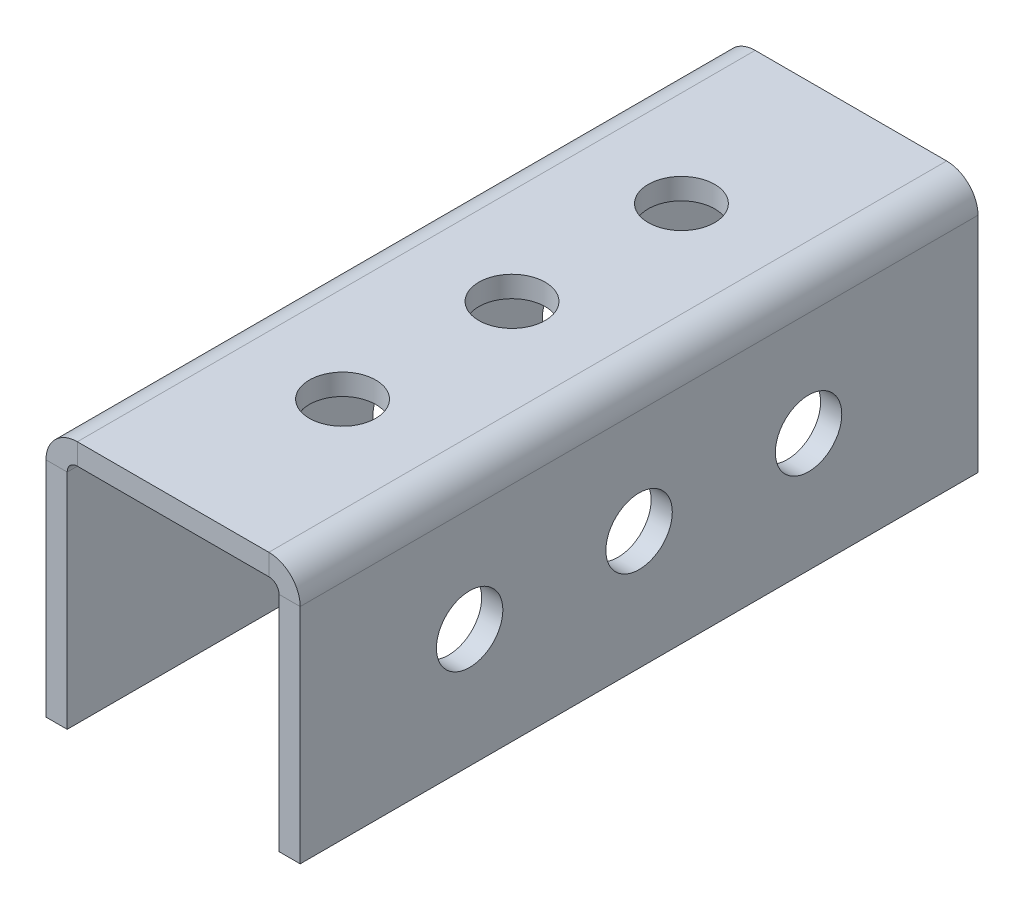
from build123d import *

# Parameters (mm, degrees)
BASE_FLANGE1_DEPTH = 50.8
SKETCH6_R          = 2.4892
CUT_EXTRUDE1_DEPTH = 56.084191244
SKETCH7_R          = 2.4892
CUT_EXTRUDE2_DEPTH = 58.501695627


# Sheet-metal steps are written as plain solids
with BuildPart() as part:
    # Sketch1 → Base-Flange1 (new body)
    with BuildSketch(Plane.XY):
        with BuildLine():
            Line((-9.525, 0), (-9.525, 16.7005))
            ThreePointArc((-9.525, 16.7005), (-8.836847382, 18.361847382), (-7.1755, 19.05))
            Line((-7.1755, 19.05), (7.1755, 19.05))
            ThreePointArc((7.1755, 19.05), (8.836847382, 18.361847382), (9.525, 16.7005))
            Line((9.525, 16.7005), (9.525, 0))
            Line((9.525, 0), (7.9375, 0))
            Line((7.9375, 0), (7.9375, 16.7005))
            ThreePointArc((7.9375, 16.7005), (7.714315367, 17.239315367), (7.1755, 17.4625))
            Line((7.1755, 17.4625), (-7.1755, 17.4625))
            ThreePointArc((-7.1755, 17.4625), (-7.714315367, 17.239315367), (-7.9375, 16.7005))
            Line((-7.9375, 16.7005), (-7.9375, 0))
            Line((-7.9375, 0), (-9.525, 0))
        make_face()
    extrude(amount=BASE_FLANGE1_DEPTH)

    # Sketch6 → Cut-Extrude1 (cut, through all)
    with BuildSketch(Plane(origin=(0, 19.05, 0), x_dir=(1, 0, 0), z_dir=(0, 1, 0))):
        with Locations(Location((0, -12.7, 0), (0, 0, 270))):
            Circle(SKETCH6_R)
        with Locations(Location((0, -25.4, 0), (0, 0, 270))):
            Circle(SKETCH6_R)
        with Locations(Location((0, -38.1, 0), (0, 0, 270))):
            Circle(SKETCH6_R)
    extrude(amount=-CUT_EXTRUDE1_DEPTH, mode=Mode.SUBTRACT)

    # Sketch7 → Cut-Extrude2 (cut, through all)
    with BuildSketch(Plane(origin=(9.525, 0, 0), x_dir=(0, 0, -1), z_dir=(1, 0, 0))):
        with Locations((-25.4, 8.89)):
            Circle(SKETCH7_R)
        with Locations((-12.7, 8.89)):
            Circle(SKETCH7_R)
        with Locations((-38.1, 8.89)):
            Circle(SKETCH7_R)
    extrude(amount=-CUT_EXTRUDE2_DEPTH, mode=Mode.SUBTRACT)


solid = part.part
